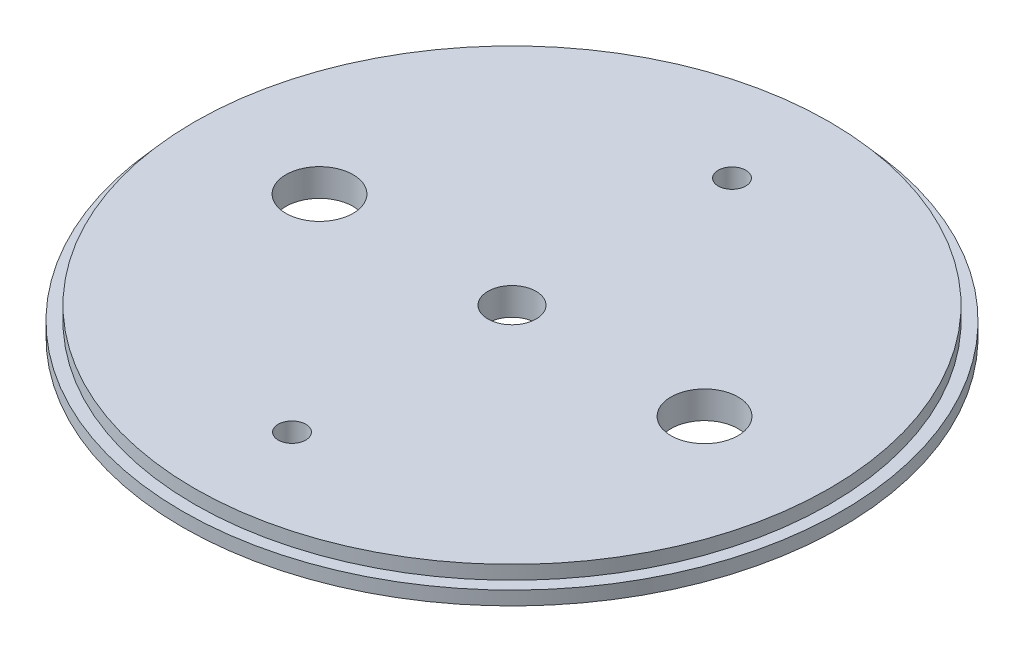
from build123d import *

# Parameters (mm, degrees)
SKETCH1_R                   = 76.0984
BOSS_EXTRUDE1_DEPTH         = 3.175
SKETCH1_3_R                 = 73.3171
BOSS_EXTRUDE2_DEPTH         = 6.35
F_1_4_0_25_DIAMETER_HOLE1_D = 6.35
M18X2_5_TAPPED_HOLE1_D      = 15.5
SKETCH3_3_R                 = 5.55625
CUT_EXTRUDE2_DEPTH          = 108.806565037


with BuildPart() as part:
    # Sketch1 → Boss-Extrude1 (new body)
    with BuildSketch(Plane(origin=(0, 0, 0), x_dir=(1, 0, 0), z_dir=(0, 1, 0))):
        Circle(SKETCH1_R)
    extrude(amount=BOSS_EXTRUDE1_DEPTH)

    # Sketch1<3> → Boss-Extrude2 (add)
    with BuildSketch(Plane(origin=(0, 0, 0), x_dir=(1, 0, 0), z_dir=(0, 1, 0))):
        Circle(SKETCH1_3_R)
    extrude(amount=BOSS_EXTRUDE2_DEPTH)

    # 1/4 (0.25) Diameter Hole1 (through all)
    with Locations(Plane(origin=(0, 0, 0), x_dir=(-1, 0, 0), z_dir=(0, -1, 0))):
        with Locations((0, 50.8), (0, -50.8)):
            Hole(F_1_4_0_25_DIAMETER_HOLE1_D / 2)

    # M18x2.5 Tapped Hole1 (through all)
    with Locations(Plane(origin=(0, 0, 0), x_dir=(-1, 0, 0), z_dir=(0, -1, 0))):
        with Locations((44.45, 0), (-44.45, 0)):
            Hole(M18X2_5_TAPPED_HOLE1_D / 2)

    # Sketch3<3> → Cut-Extrude2 (cut, through all)
    with BuildSketch(Plane.XZ):
        Circle(SKETCH3_3_R)
    extrude(amount=-CUT_EXTRUDE2_DEPTH, mode=Mode.SUBTRACT)


solid = part.part
